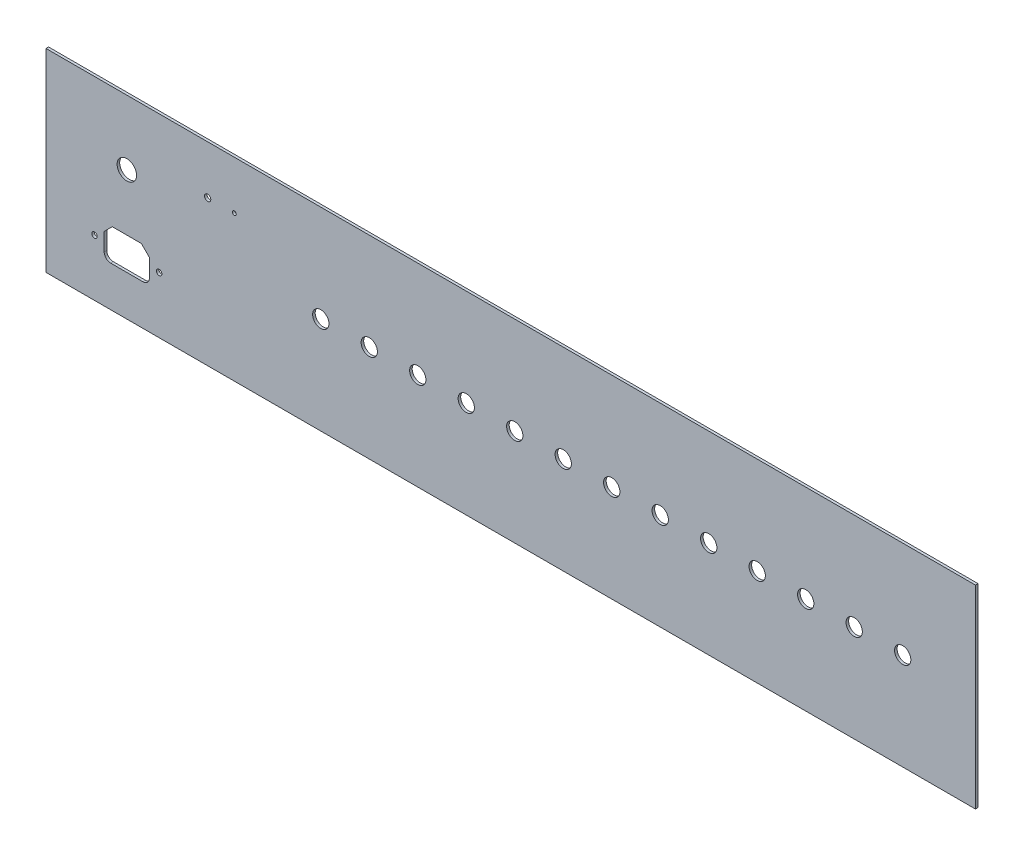
from build123d import *

# Parameters (mm, degrees)
SKETCH1_W               = 575
SKETCH1_H               = 120
BOSS_EXTRUDE1_DEPTH     = 1.5875
M3_CLEARANCE_HOLE1_D    = 3.4
F_3_8_CLEARANCE_HOLE1_D = 10.0838
LPATTERN1_COUNT         = 13
LPATTERN1_PITCH         = 30
CUT_EXTRUDE1_REACH      = 295.698
SKETCH8_R               = 1.95
SKETCH8_R_2             = 1.2
CUT_EXTRUDE2_REACH      = 295.698
SKETCH9_W               = 28
SKETCH9_H               = 20
FILLET1_R               = 4
CHAMFER1_SIZE           = 5
CUT_EXTRUDE3_REACH      = 295.698
SKETCH10_R              = 6


with BuildPart() as part:
    # Sketch1 → Boss-Extrude1 (new body)
    with BuildSketch(Plane.XY):
        Rectangle(SKETCH1_W, SKETCH1_H)
    extrude(amount=BOSS_EXTRUDE1_DEPTH)

    # M3 Clearance Hole1 (through all)
    with Locations(Plane.XY.offset(1.5875)):
        with Locations((-257.5, -25), (-217.5, -25)):
            Hole(M3_CLEARANCE_HOLE1_D / 2)

    # 3/8 Clearance Hole1 (through all)
    with Locations(Plane.XY.offset(1.5875)):
        with Locations((-117.5, 0)):
            f_3_8_clearance_hole1 = Hole(F_3_8_CLEARANCE_HOLE1_D / 2)

    # LPattern1: 3/8 Clearance Hole1 ×13
    with Locations(*[(i * LPATTERN1_PITCH, 0, 0) for i in range(1, LPATTERN1_COUNT)]):
        add(f_3_8_clearance_hole1, mode=Mode.SUBTRACT)

    # Sketch8 → Cut-Extrude1 (cut, up to next)
    with BuildSketch(Plane.XY.offset(1.5875), mode=Mode.PRIVATE) as cut_extrude1_sk1:
        with Locations((-187.5, 30)):
            Circle(SKETCH8_R)
    cut_extrude1_tool1 = extrude(cut_extrude1_sk1.sketch, amount=-CUT_EXTRUDE1_REACH, mode=Mode.PRIVATE) & part.part
    # Sketch8 → Cut-Extrude1 (cut, up to next)
    with BuildSketch(Plane.XY.offset(1.5875), mode=Mode.PRIVATE) as cut_extrude1_sk2:
        with Locations((-170.99, 30)):
            Circle(SKETCH8_R_2)
    cut_extrude1_tool2 = extrude(cut_extrude1_sk2.sketch, amount=-CUT_EXTRUDE1_REACH, mode=Mode.PRIVATE) & part.part
    add(cut_extrude1_tool1.solids().sort_by_distance((-187.5, 30, 1.5875))[0], mode=Mode.SUBTRACT)
    add(cut_extrude1_tool2.solids().sort_by_distance((-170.99, 30, 1.5875))[0], mode=Mode.SUBTRACT)

    # Sketch9 → Cut-Extrude2 (cut, up to next)
    with BuildSketch(Plane.XY.offset(1.5875), mode=Mode.PRIVATE) as cut_extrude2_sk1:
        with Locations((-237.5, -25)):
            Rectangle(SKETCH9_W, SKETCH9_H)
    cut_extrude2_tool1 = extrude(cut_extrude2_sk1.sketch, amount=-CUT_EXTRUDE2_REACH, mode=Mode.PRIVATE) & part.part
    add(cut_extrude2_tool1.solids().sort_by_distance((-237.5, -25, 1.5875))[0], mode=Mode.SUBTRACT)

    # Fillet1
    fillet1_edges = [part.edges().sort_by_distance(p)[0] for p in [
        (-223.5, -35, 0.79375),
        (-251.5, -35, 0.79375),
    ]]
    fillet(fillet1_edges, radius=FILLET1_R)

    # Chamfer1
    chamfer1_edges = [part.edges().sort_by_distance(p)[0] for p in [
        (-223.5, -15, 0.79375),
        (-251.5, -15, 0.79375),
    ]]
    chamfer(chamfer1_edges, length=CHAMFER1_SIZE)

    # Sketch10 → Cut-Extrude3 (cut, up to next)
    with BuildSketch(Plane.XY.offset(1.5875), mode=Mode.PRIVATE) as cut_extrude3_sk1:
        with Locations((-237.5, 20)):
            Circle(SKETCH10_R)
    cut_extrude3_tool1 = extrude(cut_extrude3_sk1.sketch, amount=-CUT_EXTRUDE3_REACH, mode=Mode.PRIVATE) & part.part
    add(cut_extrude3_tool1.solids().sort_by_distance((-237.5, 20, 1.5875))[0], mode=Mode.SUBTRACT)


solid = part.part
